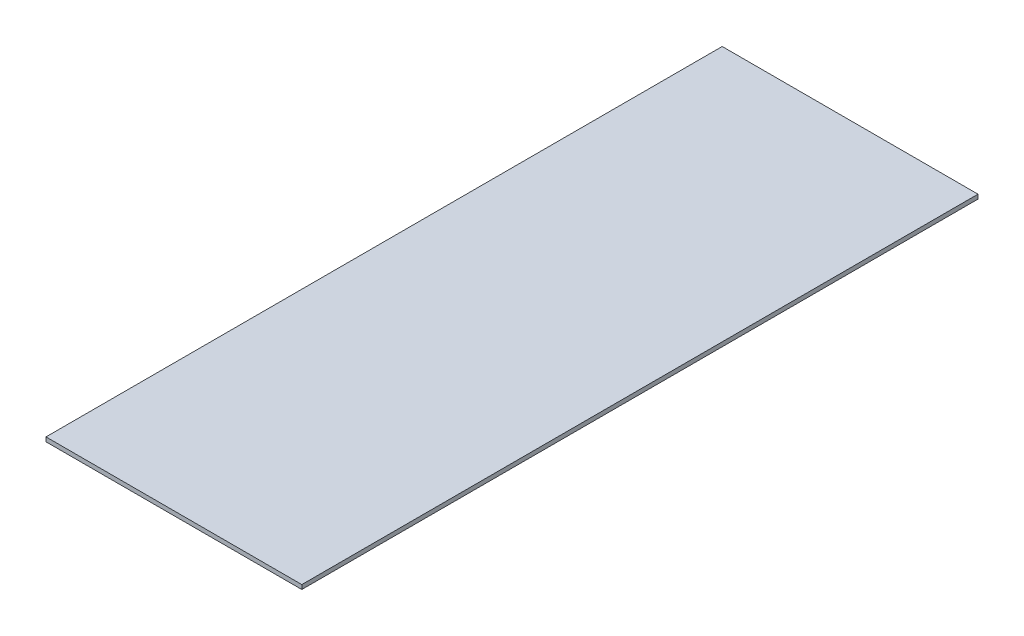
from build123d import *

# Parameters (mm, degrees)
SKETCH_1_W      = 179.06
SKETCH_1_H      = 473.33
EXTRUDE_1_DEPTH = 3


with BuildPart() as part:
    # 草图1 → 凸台-拉伸1 (new body)
    with BuildSketch(Plane(origin=(0, 0, 0), x_dir=(1, 0, 0), z_dir=(0, 1, 0))):
        Rectangle(SKETCH_1_W, SKETCH_1_H)
    extrude(amount=EXTRUDE_1_DEPTH)


solid = part.part
